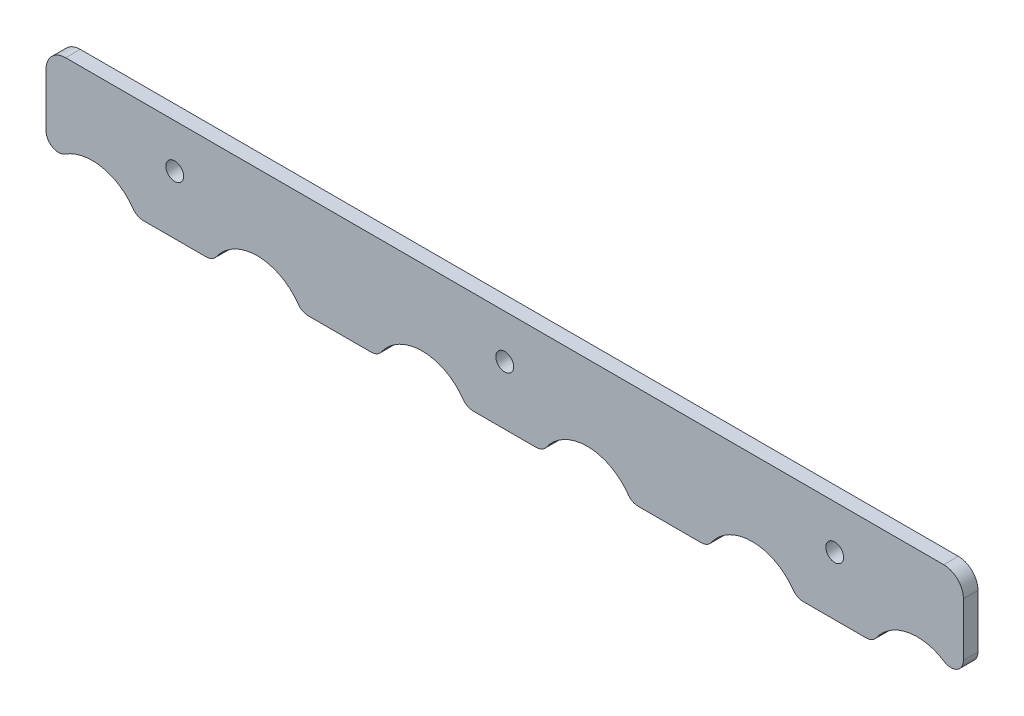
from build123d import *

# Parameters (mm, degrees)
BOSS_EXTRUDE1_DEPTH = 2.032
FILLET1_R           = 3
FILLET2_R           = 2
SKETCH4_R           = 1.2446
CUT_EXTRUDE1_DEPTH  = 136.528598113
CUT_EXTRUDE2_DEPTH  = 136.528598113


with BuildPart() as part:
    # Sketch3 → Boss-Extrude1 (new body)
    with BuildSketch(Plane.XY):
        with BuildLine():
            ThreePointArc((4.075, 10.775), (9.233659082, 17.295296632), (16.76582632, 13.775))
            Line((16.76582632, 13.775), (27.78417368, 13.775))
            ThreePointArc((27.78417368, 13.775), (33.775, 17.475), (39.76582632, 13.775))
            Line((39.76582632, 13.775), (50.78417368, 13.775))
            ThreePointArc((50.78417368, 13.775), (56.775, 17.475), (62.76582632, 13.775))
            Line((62.76582632, 13.775), (73.78417368, 13.775))
            ThreePointArc((73.78417368, 13.775), (79.775, 17.475), (85.76582632, 13.775))
            Line((85.76582632, 13.775), (96.78417368, 13.775))
            ThreePointArc((96.78417368, 13.775), (102.775, 17.475), (108.76582632, 13.775))
            Line((108.76582632, 13.775), (119.78417368, 13.775))
            ThreePointArc((119.78417368, 13.775), (127.316340918, 17.295296632), (132.475, 10.775))
            Line((132.475, 10.775), (132.475, 28.535))
            Line((132.475, 28.535), (4.075, 28.535))
            Line((4.075, 28.535), (4.075, 10.775))
        make_face()
    extrude(amount=BOSS_EXTRUDE1_DEPTH)

    # Fillet1
    fillet1_edges = [part.edges().sort_by_distance(p)[0] for p in [
        (4.075, 28.535, 1.016),
        (132.475, 28.535, 1.016),
    ]]
    fillet(fillet1_edges, radius=FILLET1_R)

    # Fillet2
    fillet2_edges = [part.edges().sort_by_distance(p)[0] for p in [
        (119.78417368, 13.775, 1.016),
    ]]
    fillet(fillet2_edges, radius=FILLET2_R)
    fillet2_2_edges = [part.edges().sort_by_distance(p)[0] for p in [
        (108.76582632, 13.775, 1.016),
    ]]
    fillet(fillet2_2_edges, radius=FILLET2_R)
    fillet2_3_edges = [part.edges().sort_by_distance(p)[0] for p in [
        (96.78417368, 13.775, 1.016),
    ]]
    fillet(fillet2_3_edges, radius=FILLET2_R)
    fillet2_4_edges = [part.edges().sort_by_distance(p)[0] for p in [
        (4.075, 10.775, 1.016),
    ]]
    fillet(fillet2_4_edges, radius=FILLET2_R)
    fillet2_5_edges = [part.edges().sort_by_distance(p)[0] for p in [
        (85.76582632, 13.775, 1.016),
    ]]
    fillet(fillet2_5_edges, radius=FILLET2_R)
    fillet2_6_edges = [part.edges().sort_by_distance(p)[0] for p in [
        (16.76582632, 13.775, 1.016),
    ]]
    fillet(fillet2_6_edges, radius=FILLET2_R)
    fillet2_7_edges = [part.edges().sort_by_distance(p)[0] for p in [
        (73.78417368, 13.775, 1.016),
    ]]
    fillet(fillet2_7_edges, radius=FILLET2_R)
    fillet2_8_edges = [part.edges().sort_by_distance(p)[0] for p in [
        (27.78417368, 13.775, 1.016),
    ]]
    fillet(fillet2_8_edges, radius=FILLET2_R)
    fillet2_9_edges = [part.edges().sort_by_distance(p)[0] for p in [
        (62.76582632, 13.775, 1.016),
    ]]
    fillet(fillet2_9_edges, radius=FILLET2_R)
    fillet2_10_edges = [part.edges().sort_by_distance(p)[0] for p in [
        (39.76582632, 13.775, 1.016),
    ]]
    fillet(fillet2_10_edges, radius=FILLET2_R)
    fillet2_11_edges = [part.edges().sort_by_distance(p)[0] for p in [
        (50.78417368, 13.775, 1.016),
    ]]
    fillet(fillet2_11_edges, radius=FILLET2_R)
    fillet2_12_edges = [part.edges().sort_by_distance(p)[0] for p in [
        (132.475, 10.775, 1.016),
    ]]
    fillet(fillet2_12_edges, radius=FILLET2_R)

    # Sketch4 → Cut-Extrude1 (cut, through all)
    with BuildSketch(Plane(origin=(0, 0, 0), x_dir=(-1, 0, 0), z_dir=(0, 0, -1))):
        with Locations((-22.275, 22.185)):
            Circle(SKETCH4_R)
        with Locations((-68.275, 22.185)):
            Circle(SKETCH4_R)
        with Locations((-114.275, 22.185)):
            Circle(SKETCH4_R)
    extrude(amount=-CUT_EXTRUDE1_DEPTH, mode=Mode.SUBTRACT)

    # Sketch5 → Cut-Extrude2 (cut, through all)
    with BuildSketch(Plane.XY.offset(2.032)):
        with BuildLine():
            Line((132.475, 18.096202087), (132.475, 25.535))
            ThreePointArc((132.475, 25.535), (131.596320344, 27.656320344), (129.475, 28.535))
            Line((129.475, 28.535), (7.075, 28.535))
            ThreePointArc((7.075, 28.535), (4.953679656, 27.656320344), (4.075, 25.535))
            Line((4.075, 25.535), (4.075, 18.096202087))
            ThreePointArc((4.075, 18.096202087), (5.116073397, 16.341078225), (7.15545977, 16.413167125))
            ThreePointArc((7.15545977, 16.413167125), (12.066113474, 17.349422104), (16.257980429, 14.625574713))
            ThreePointArc((16.257980429, 14.625574713), (16.97242493, 14.000337979), (17.894691005, 13.775))
            Line((17.894691005, 13.775), (26.655308995, 13.775))
            ThreePointArc((26.655308995, 13.775), (27.57757507, 14.000337979), (28.292019571, 14.625574713))
            ThreePointArc((28.292019571, 14.625574713), (33.775, 17.475), (39.257980429, 14.625574713))
            ThreePointArc((39.257980429, 14.625574713), (39.97242493, 14.000337979), (40.894691005, 13.775))
            Line((40.894691005, 13.775), (49.655308995, 13.775))
            ThreePointArc((49.655308995, 13.775), (50.57757507, 14.000337979), (51.292019571, 14.625574713))
            ThreePointArc((51.292019571, 14.625574713), (56.775, 17.475), (62.257980429, 14.625574713))
            ThreePointArc((62.257980429, 14.625574713), (62.97242493, 14.000337979), (63.894691005, 13.775))
            Line((63.894691005, 13.775), (72.655308995, 13.775))
            ThreePointArc((72.655308995, 13.775), (73.57757507, 14.000337979), (74.292019571, 14.625574713))
            ThreePointArc((74.292019571, 14.625574713), (79.775, 17.475), (85.257980429, 14.625574713))
            ThreePointArc((85.257980429, 14.625574713), (85.97242493, 14.000337979), (86.894691005, 13.775))
            Line((86.894691005, 13.775), (95.655308995, 13.775))
            ThreePointArc((95.655308995, 13.775), (96.57757507, 14.000337979), (97.292019571, 14.625574713))
            ThreePointArc((97.292019571, 14.625574713), (102.775, 17.475), (108.257980429, 14.625574713))
            ThreePointArc((108.257980429, 14.625574713), (108.97242493, 14.000337979), (109.894691005, 13.775))
            Line((109.894691005, 13.775), (118.655308995, 13.775))
            ThreePointArc((118.655308995, 13.775), (119.57757507, 14.000337979), (120.292019571, 14.625574713))
            ThreePointArc((120.292019571, 14.625574713), (124.483886526, 17.349422104), (129.39454023, 16.413167125))
            ThreePointArc((129.39454023, 16.413167125), (131.433926603, 16.341078225), (132.475, 18.096202087))
        make_face()
        with BuildLine():
            Line((4.329, 25.535), (4.329, 18.096202087))
            ThreePointArc((4.329, 18.096202087), (5.237857076, 16.563978956), (7.018241379, 16.626912565))
            ThreePointArc((7.018241379, 16.626912565), (12.115060163, 17.598661389), (16.465842672, 14.771551724))
            ThreePointArc((16.465842672, 14.771551724), (17.089552721, 14.225720056), (17.894691005, 14.029))
            Line((17.894691005, 14.029), (26.655308995, 14.029))
            ThreePointArc((26.655308995, 14.029), (27.460447279, 14.225720056), (28.084157328, 14.771551724))
            ThreePointArc((28.084157328, 14.771551724), (33.775, 17.729), (39.465842672, 14.771551724))
            ThreePointArc((39.465842672, 14.771551724), (40.089552721, 14.225720056), (40.894691005, 14.029))
            Line((40.894691005, 14.029), (49.655308995, 14.029))
            ThreePointArc((49.655308995, 14.029), (50.460447279, 14.225720056), (51.084157328, 14.771551724))
            ThreePointArc((51.084157328, 14.771551724), (56.775, 17.729), (62.465842672, 14.771551724))
            ThreePointArc((62.465842672, 14.771551724), (63.089552721, 14.225720056), (63.894691005, 14.029))
            Line((63.894691005, 14.029), (72.655308995, 14.029))
            ThreePointArc((72.655308995, 14.029), (73.460447279, 14.225720056), (74.084157328, 14.771551724))
            ThreePointArc((74.084157328, 14.771551724), (79.775, 17.729), (85.465842672, 14.771551724))
            ThreePointArc((85.465842672, 14.771551724), (86.089552721, 14.225720056), (86.894691005, 14.029))
            Line((86.894691005, 14.029), (95.655308995, 14.029))
            ThreePointArc((95.655308995, 14.029), (96.460447279, 14.225720056), (97.084157328, 14.771551724))
            ThreePointArc((97.084157328, 14.771551724), (102.775, 17.729), (108.465842672, 14.771551724))
            ThreePointArc((108.465842672, 14.771551724), (109.089552721, 14.225720056), (109.894691005, 14.029))
            Line((109.894691005, 14.029), (118.655308995, 14.029))
            ThreePointArc((118.655308995, 14.029), (119.460447279, 14.225720056), (120.084157328, 14.771551724))
            ThreePointArc((120.084157328, 14.771551724), (124.434939837, 17.598661389), (129.531758621, 16.626912565))
            ThreePointArc((129.531758621, 16.626912565), (131.312142924, 16.563978956), (132.221, 18.096202087))
            Line((132.221, 18.096202087), (132.221, 25.535))
            ThreePointArc((132.221, 25.535), (131.416715221, 27.476715221), (129.475, 28.281))
            Line((129.475, 28.281), (7.075, 28.281))
            ThreePointArc((7.075, 28.281), (5.133284779, 27.476715221), (4.329, 25.535))
        make_face(mode=Mode.SUBTRACT)
    extrude(amount=-CUT_EXTRUDE2_DEPTH, mode=Mode.SUBTRACT)


solid = part.part
